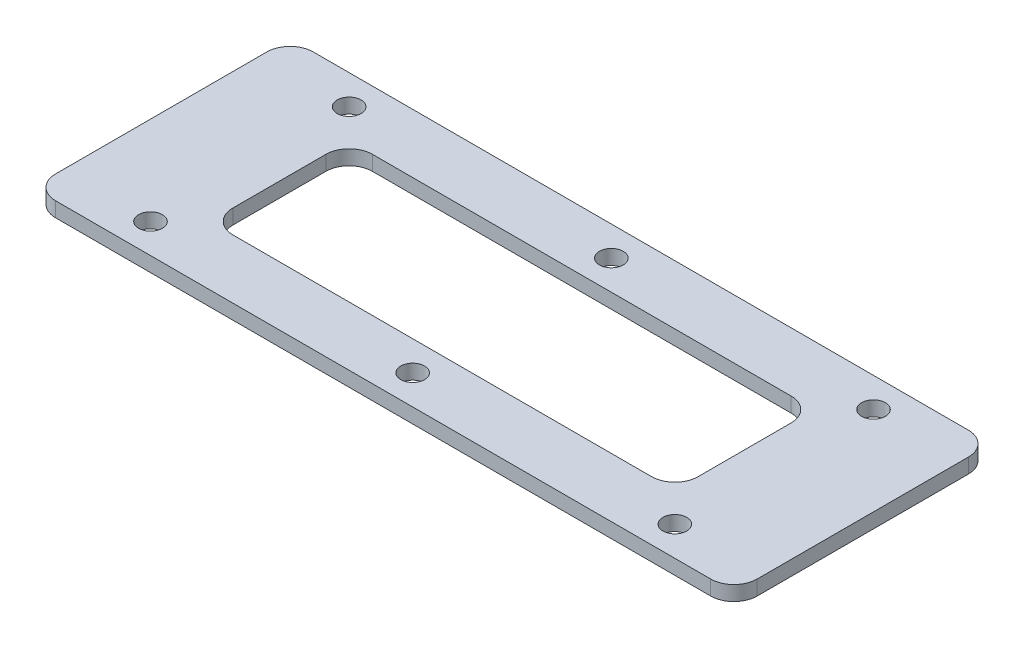
from build123d import *

# Parameters (mm, degrees)
SKETCH1_R           = 2.5527
BOSS_EXTRUDE1_DEPTH = 3.175


with BuildPart() as part:
    # Sketch1 → Boss-Extrude1 (new body)
    with BuildSketch(Plane(origin=(0, 0, 0), x_dir=(1, 0, 0), z_dir=(0, 1, 0))):
        with BuildLine():
            Line((-75.4, 22.7), (-75.4, 0))
            Line((-75.4, 0), (-75.4, -22.7))
            ThreePointArc((-75.4, -22.7), (-73.935533906, -26.235533906), (-70.4, -27.7))
            Line((-70.4, -27.7), (70.4, -27.7))
            ThreePointArc((70.4, -27.7), (73.935533906, -26.235533906), (75.4, -22.7))
            Line((75.4, -22.7), (75.4, 0))
            Line((75.4, 0), (75.4, 22.7))
            ThreePointArc((75.4, 22.7), (73.935533906, 26.235533906), (70.4, 27.7))
            Line((70.4, 27.7), (-70.4, 27.7))
            ThreePointArc((-70.4, 27.7), (-73.935533906, 26.235533906), (-75.4, 22.7))
        make_face()
        with Locations((-56.35, -21.35)):
            Circle(SKETCH1_R, mode=Mode.SUBTRACT)
        with Locations((0, -21.35)):
            Circle(SKETCH1_R, mode=Mode.SUBTRACT)
        with Locations((56.35, -21.35)):
            Circle(SKETCH1_R, mode=Mode.SUBTRACT)
        with Locations((56.35, 21.35)):
            Circle(SKETCH1_R, mode=Mode.SUBTRACT)
        with Locations((0, 21.35)):
            Circle(SKETCH1_R, mode=Mode.SUBTRACT)
        with Locations((-56.35, 21.35)):
            Circle(SKETCH1_R, mode=Mode.SUBTRACT)
        with BuildLine():
            Line((45, 15), (-45, 15))
            ThreePointArc((-45, 15), (-48.535533906, 13.535533906), (-50, 10))
            Line((-50, 10), (-50, -10))
            ThreePointArc((-50, -10), (-48.535533906, -13.535533906), (-45, -15))
            Line((-45, -15), (45, -15))
            ThreePointArc((45, -15), (48.535533906, -13.535533906), (50, -10))
            Line((50, -10), (50, 10))
            ThreePointArc((50, 10), (48.535533906, 13.535533906), (45, 15))
        make_face(mode=Mode.SUBTRACT)
    extrude(amount=BOSS_EXTRUDE1_DEPTH)


solid = part.part
